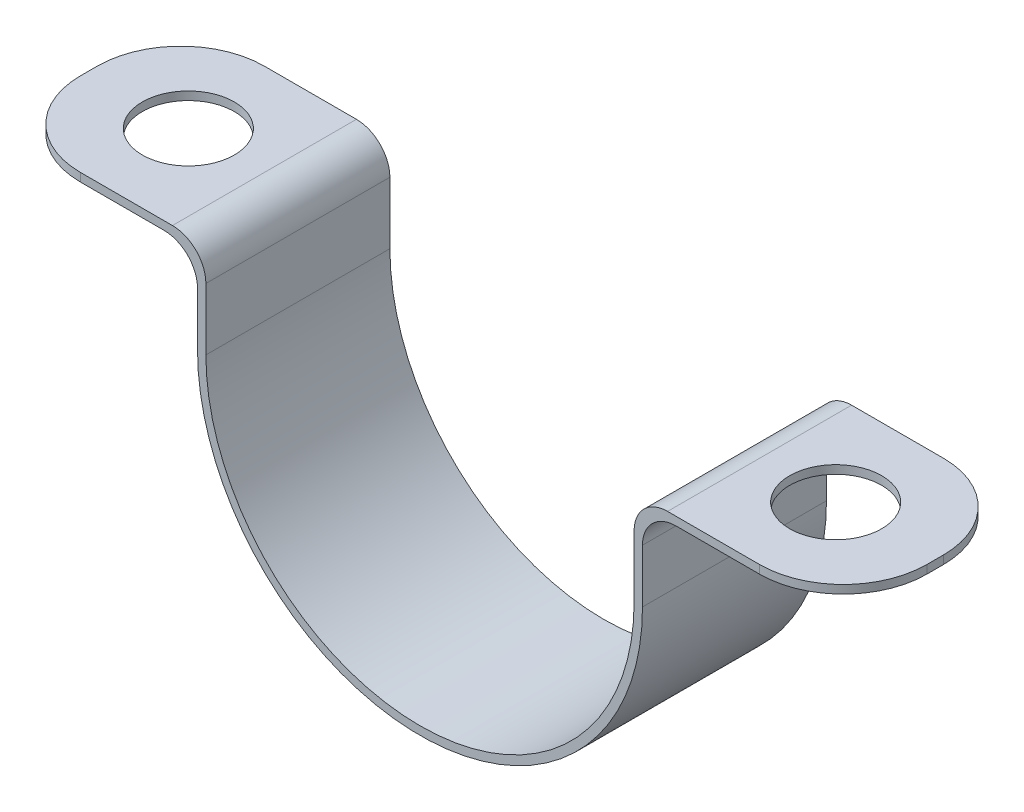
from build123d import *

# Parameters (mm, degrees)
BASE_FLANGE1_DEPTH = 11
FILLET1_R          = 5
SKETCH6_R          = 2.75
CUT_EXTRUDE1_DEPTH = 10


# Sheet-metal steps are written as plain solids
with BuildPart() as part:
    # Sketch1 → Base-Flange1 (new body)
    with BuildSketch(Plane.XY):
        with BuildLine():
            Line((-12.8, 0), (-12.8, 3.7))
            ThreePointArc((-12.8, 3.7), (-13.385786438, 5.114213562), (-14.8, 5.7))
            Line((-14.8, 5.7), (-25.3, 5.7))
            Line((-25.3, 5.7), (-25.3, 5.2))
            Line((-25.3, 5.2), (-15.3, 5.2))
            ThreePointArc((-15.3, 5.2), (-13.885786438, 4.614213562), (-13.3, 3.2))
            Line((-13.3, 3.2), (-13.3, 0))
            ThreePointArc((-13.3, 0), (0, -13.3), (13.3, 0))
            Line((13.3, 0), (13.3, 3.2))
            ThreePointArc((13.3, 3.2), (13.885786438, 4.614213562), (15.3, 5.2))
            Line((15.3, 5.2), (25.3, 5.2))
            Line((25.3, 5.2), (25.3, 5.7))
            Line((25.3, 5.7), (14.8, 5.7))
            ThreePointArc((14.8, 5.7), (13.385786438, 5.114213562), (12.8, 3.7))
            Line((12.8, 3.7), (12.8, 0))
            ThreePointArc((12.8, 0), (0, -12.8), (-12.8, 0))
        make_face()
    extrude(amount=-BASE_FLANGE1_DEPTH)

    # Fillet1
    fillet1_edges = [part.edges().sort_by_distance(p)[0] for p in [
        (25.3, 5.45, 0),
        (-25.3, 5.45, 0),
        (-25.3, 5.45, -11),
        (25.3, 5.45, -11),
    ]]
    fillet(fillet1_edges, radius=FILLET1_R)

    # Sketch6 → Cut-Extrude1 (cut)
    with BuildSketch(Plane(origin=(0, 0, 0), x_dir=(1, 0, 0), z_dir=(0, 1, 0))):
        with Locations((19.35, 5.5)):
            Circle(SKETCH6_R)
        with Locations((-19.35, 5.5)):
            Circle(SKETCH6_R)
    extrude(amount=CUT_EXTRUDE1_DEPTH, mode=Mode.SUBTRACT)


solid = part.part
